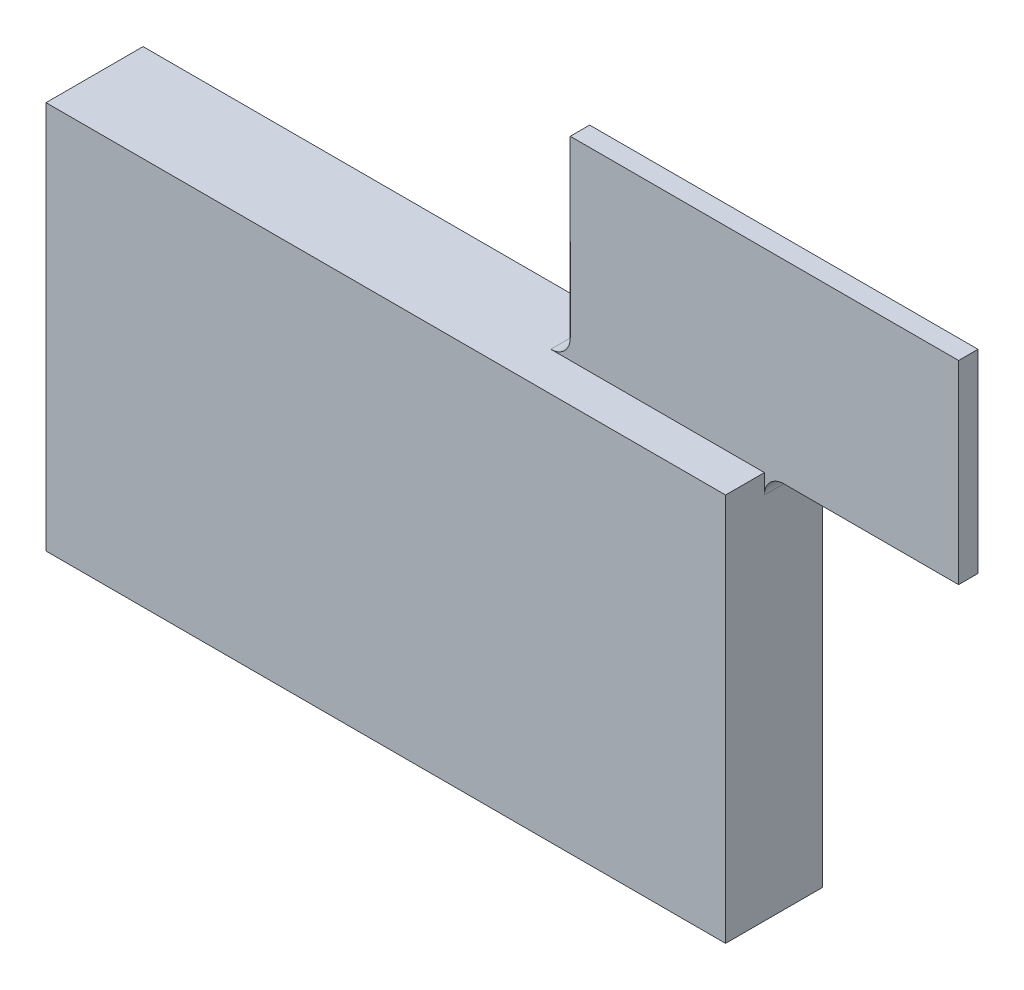
from build123d import *

# Parameters (mm, degrees)
ESQUISSE1_W        = 35
ESQUISSE1_H        = 5
BOSS_EXTRU_1_DEPTH = 20
ESQUISSE2_W        = 20
ESQUISSE2_H        = 1
BOSS_EXTRU_2_DEPTH = 10
CONG_1_R           = 1


with BuildPart() as part:
    # Esquisse1 → Boss.-Extru.1 (new body)
    with BuildSketch(Plane(origin=(0, 0, 0), x_dir=(1, 0, 0), z_dir=(0, 1, 0))):
        Rectangle(ESQUISSE1_W, ESQUISSE1_H)
    extrude(amount=BOSS_EXTRU_1_DEPTH)

    # Esquisse2 → Boss.-Extru.2 (add)
    with BuildSketch(Plane(origin=(0, 20, 0), x_dir=(1, 0, 0), z_dir=(0, 1, 0))):
        with Locations((17.5, 0)):
            Rectangle(ESQUISSE2_W, ESQUISSE2_H)
    extrude(amount=BOSS_EXTRU_2_DEPTH)

    # Congé1
    cong_1_edges = [part.edges().sort_by_distance(p)[0] for p in [
        (7.5, 20, 0),
        (17.5, 20, 0),
    ]]
    fillet(cong_1_edges, radius=CONG_1_R)


solid = part.part
